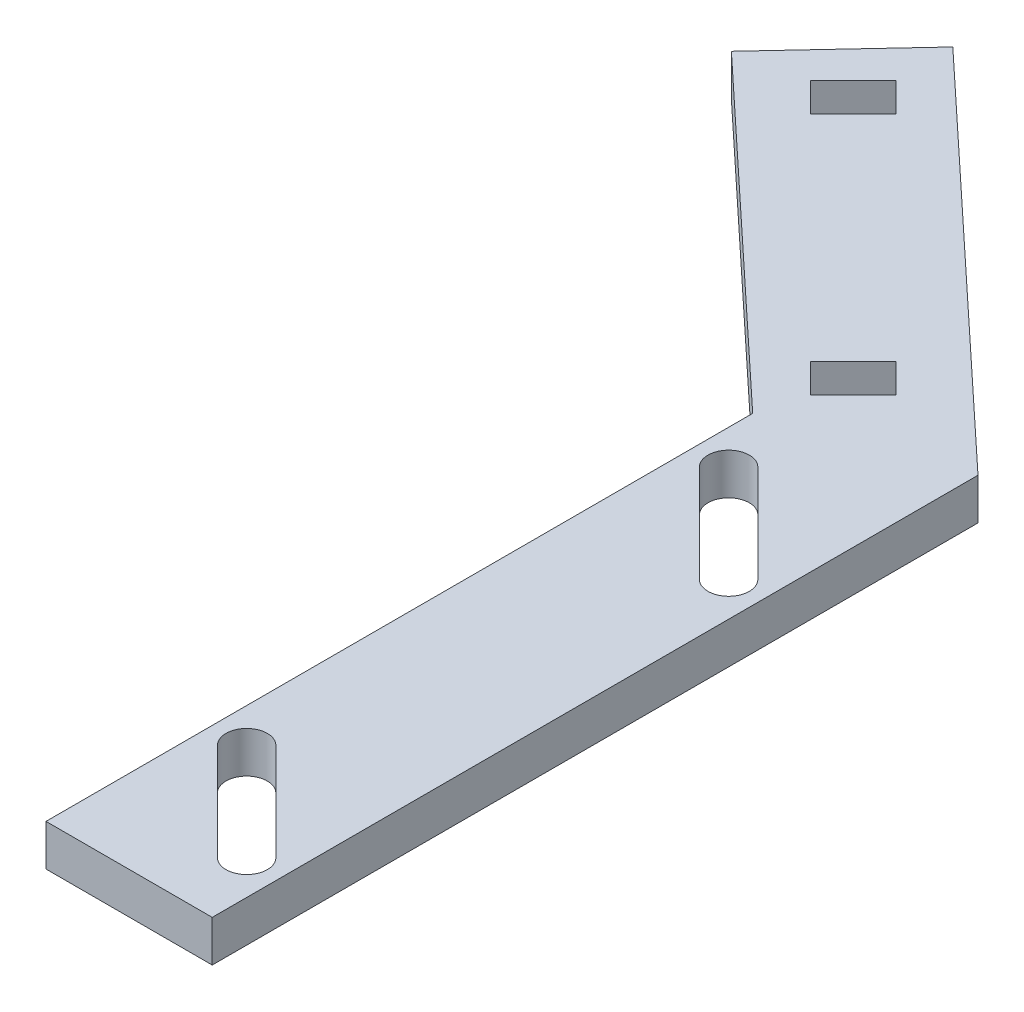
from build123d import *

# Parameters (mm, degrees)
BOSS_EXTRUDE1_DEPTH = 3


with BuildPart() as part:
    # Sketch2 → Boss-Extrude1 (new body)
    with BuildSketch(Plane(origin=(0, 0, 0), x_dir=(1, 0, 0), z_dir=(0, 1, 0))):
        Polygon((6.881727984, 48.346499533), (3.554575269, 51.455089945), (-20.966484983, 74.365349656), (-28.733306307, 66.052449843), (-5.189339828, 44.055098134), (-5.189339828, 39.079197071), (-5.189339828, -0.189339828), (-5.189339828, -7.26040764), (6.881727984, -7.26040764), (6.881727984, 44.810660172), align=None)
        with BuildLine():
            ThreePointArc((-3.75, 3.75), (-3.75, 5.871320344), (-1.628679656, 5.871320344))
            Line((-1.628679656, 5.871320344), (5.442388155, -1.199747468))
            ThreePointArc((5.442388155, -1.199747468), (5.442388155, -3.321067812), (3.321067812, -3.321067812))
            Line((3.321067812, -3.321067812), (-3.75, 3.75))
        make_face(mode=Mode.SUBTRACT)
        Polygon((-24.044495374, 67.097629912), (-20.933225537, 70.208899749), (-18.811905193, 68.087579406), (-21.923175031, 64.976309569), align=None, mode=Mode.SUBTRACT)
        Polygon((-6.366825845, 49.419960382), (-3.255556007, 52.53123022), (-1.134235664, 50.409909876), (-4.245505501, 47.298640039), align=None, mode=Mode.SUBTRACT)
        with BuildLine():
            ThreePointArc((-3.75, 38.75), (-3.75, 40.871320344), (-1.628679656, 40.871320344))
            Line((-1.628679656, 40.871320344), (5.442388155, 33.800252532))
            ThreePointArc((5.442388155, 33.800252532), (5.442388155, 31.678932188), (3.321067812, 31.678932188))
            Line((3.321067812, 31.678932188), (-3.75, 38.75))
        make_face(mode=Mode.SUBTRACT)
    extrude(amount=BOSS_EXTRUDE1_DEPTH)


solid = part.part
